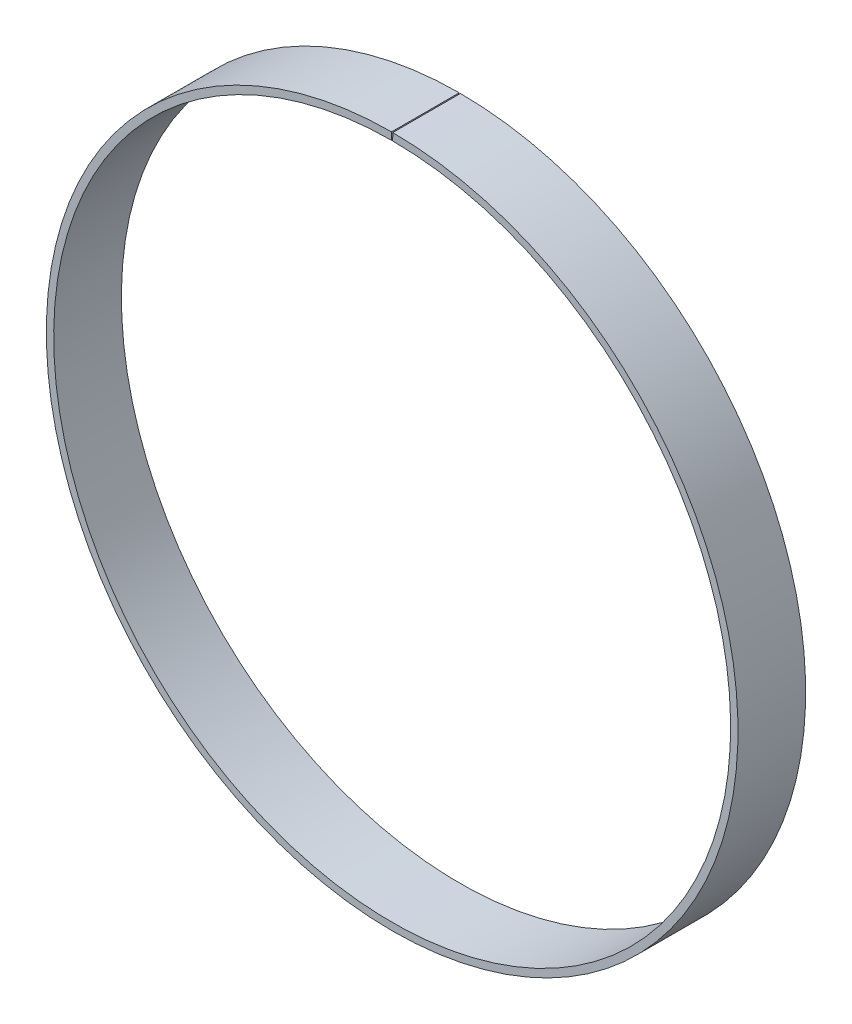
from build123d import *

# Parameters (mm, degrees)
BASE_FLANGE1_DEPTH = 23


# Sheet-metal steps are written as plain solids
with BuildPart() as part:
    # Sketch1 → Base-Flange1 (new body)
    with BuildSketch(Plane.XY):
        with BuildLine():
            ThreePointArc((-0.200712762, 114.999824845), (0, -115), (0.200712762, 114.999824845))
            Line((0.200712762, 114.999824845), (0.205076083, 117.499821037))
            ThreePointArc((0.205076083, 117.499821037), (0, -117.5), (-0.205076083, 117.499821037))
            Line((-0.205076083, 117.499821037), (-0.200712762, 114.999824845))
        make_face()
    extrude(amount=BASE_FLANGE1_DEPTH)


solid = part.part
